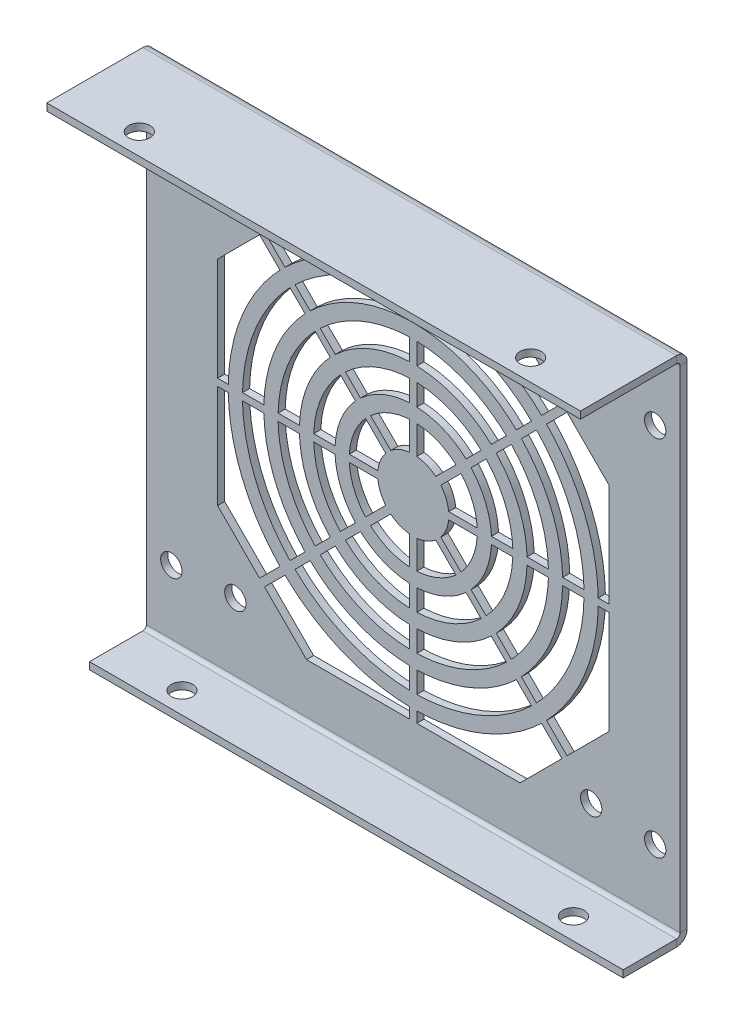
from build123d import *

# Parameters (mm, degrees)
SZKIC1_W                   = 150
SZKIC1_H                   = 138
ODGI_CIE_BAZOWE1_DEPTH     = 2
ODGI_CIE_KRAW_DZI1_DEPTH   = 150
ODGI_CIE_KRAW_DZI2_DEPTH   = 150
WYTNIJ_WYCI_GNI_CIE1_REACH = 166.757
SZKIC12_R                  = 3
OTW_R_START                = -2
OTW_R_WENTYLACYJNY1_DEPTH  = 2
WYTNIJ_WYCI_GNI_CIE2_REACH = 110.208
SZKIC14_R                  = 3
WYTNIJ_WYCI_GNI_CIE3_REACH = 166.757
SZKIC15_R                  = 3
SZKIC16_R                  = 3
WYTNIJ_WYCI_GNI_CIE4_DEPTH = 2


# Read off the part's stored shape, not the designer's step: Otwór wentylacyjny1
# Sheet-metal steps are written as plain solids
with BuildPart() as part:
    # Szkic1 → Odgięcie bazowe1 (new body)
    with BuildSketch(Plane.XY):
        Rectangle(SZKIC1_W, SZKIC1_H)
    extrude(amount=-ODGI_CIE_BAZOWE1_DEPTH)

    # Odgięcie krawędzi1 section (across the edge) → Odgięcie krawędzi1 (add)
    with BuildSketch(Plane(origin=(75, 70, 0), x_dir=(0, -1, 0), z_dir=(-1, 0, 0))):
        with BuildLine():
            Line((-2, 1), (-2, 28))
            Line((-2, 28), (0, 28))
            Line((0, 28), (0, 1))
            ThreePointArc((0, 1), (0.292893219, 0.292893219), (1, 0))
            Line((1, 0), (1, -2))
            ThreePointArc((1, -2), (-1.121320344, -1.121320344), (-2, 1))
        make_face()
    extrude(amount=ODGI_CIE_KRAW_DZI1_DEPTH)

    # Odgięcie krawędzi2 section (across the edge) → Odgięcie krawędzi2 (add)
    with BuildSketch(Plane(origin=(-75, -70, 0), x_dir=(0, 1, 0), z_dir=(1, 0, 0))):
        with BuildLine():
            Line((-2, 1), (-2, 16))
            Line((-2, 16), (0, 16))
            Line((0, 16), (0, 1))
            ThreePointArc((0, 1), (0.292893219, 0.292893219), (1, 0))
            Line((1, 0), (1, -2))
            ThreePointArc((1, -2), (-1.121320344, -1.121320344), (-2, 1))
        make_face()
    extrude(amount=ODGI_CIE_KRAW_DZI2_DEPTH)

    # Szkic12 → Wytnij-wyciągnięcie1 (cut, up to next)
    with BuildSketch(Plane.XZ.offset(72), mode=Mode.PRIVATE) as wytnij_wyci_gni_cie1_sk1:
        with Locations(Location((55, 10, 0), (0, 0, 270))):
            Circle(SZKIC12_R)
    wytnij_wyci_gni_cie1_tool1 = extrude(wytnij_wyci_gni_cie1_sk1.sketch, amount=-WYTNIJ_WYCI_GNI_CIE1_REACH, mode=Mode.PRIVATE) & part.part
    # Szkic12 → Wytnij-wyciągnięcie1 (cut, up to next)
    with BuildSketch(Plane.XZ.offset(72), mode=Mode.PRIVATE) as wytnij_wyci_gni_cie1_sk2:
        with Locations(Location((-55, 10, 0), (0, 0, 270))):
            Circle(SZKIC12_R)
    wytnij_wyci_gni_cie1_tool2 = extrude(wytnij_wyci_gni_cie1_sk2.sketch, amount=-WYTNIJ_WYCI_GNI_CIE1_REACH, mode=Mode.PRIVATE) & part.part
    add(wytnij_wyci_gni_cie1_tool1.solids().sort_by_distance((55, -72, 10))[0], mode=Mode.SUBTRACT)
    add(wytnij_wyci_gni_cie1_tool2.solids().sort_by_distance((-55, -72, 10))[0], mode=Mode.SUBTRACT)

    # Otwór wentylacyjny1 outline → Otwór wentylacyjny1 (cut)
    with BuildSketch(Plane.XY.offset(OTW_R_START)):
        with BuildLine():
            add(Edge.make_bspline(
                [(17.972154654, -0.999994577), (17.92518573, -1.843278811), (17.670657872, -3.854948802), (16.737030702, -6.932705111), (15.220903299, -9.769179978), (13.978417538, -11.37162259), (13.41533897, -12.001125464)],
                knots=[0.508846507, 0.508846507, 0.508846507, 0.508846507, 0.53125, 0.5625, 0.59375, 0.616153445, 0.616153445, 0.616153445, 0.616153445], degree=3))
            Line((17.972154654, -0.999994577), (9.949835903, -0.999992261))
            add(Edge.make_bspline(
                [(9.949835903, -0.999992261), (9.917776111, -1.318994773), (9.773684791, -2.28453532), (9.29835039, -3.851502839), (8.5264492, -5.295628394), (7.945596866, -6.080256627), (7.742697709, -6.328495177)],
                knots=[0.515942077, 0.515942077, 0.515942077, 0.515942077, 0.53125, 0.5625, 0.59375, 0.609057924, 0.609057924, 0.609057924, 0.609057924], degree=3))
            Line((7.742697709, -6.328495177), (13.41533897, -12.001125464))
        make_face()
        with BuildLine():
            Line((27.982098436, -0.999999047), (21.97721779, -0.999991626))
            add(Edge.make_bspline(
                [(21.97721779, -0.999991626), (21.926857838, -2.105291108), (21.619105132, -4.640285032), (20.456370859, -8.473306247), (18.568193593, -12.005837448), (16.993297414, -14.015961788), (16.247343743, -14.833135418)],
                knots=[0.507236801, 0.507236801, 0.507236801, 0.507236801, 0.53125, 0.5625, 0.59375, 0.617763165, 0.617763165, 0.617763165, 0.617763165], degree=3))
            Line((16.247343743, -14.833135418), (20.493438313, -19.079224751))
            add(Edge.make_bspline(
                [(27.982098436, -0.999999047), (27.928465846, -2.498222405), (27.541762876, -5.818332716), (26.035381093, -10.78420795), (23.589149965, -15.360784495), (21.514917987, -17.981897084), (20.493438313, -19.079224751)],
                knots=[0.505685352, 0.505685352, 0.505685352, 0.505685352, 0.53125, 0.5625, 0.59375, 0.619314642, 0.619314642, 0.619314642, 0.619314642], degree=3))
        make_face()
        with BuildLine():
            Line((37.986912574, -0.999999173), (31.984335524, -0.999995217))
            add(Edge.make_bspline(
                [(31.984335524, -0.999995217), (31.929202331, -2.760129716), (31.490198533, -6.603707199), (29.754721249, -12.324809086), (26.936459813, -17.597405383), (24.529063897, -20.625646567), (23.323447183, -21.909233689)],
                knots=[0.504974417, 0.504974417, 0.504974417, 0.504974417, 0.53125, 0.5625, 0.59375, 0.62002556, 0.62002556, 0.62002556, 0.62002556], degree=3))
            Line((23.323447183, -21.909233689), (27.567910075, -26.15369654))
            add(Edge.make_bspline(
                [(37.986912574, -0.999999173), (37.963083041, -1.909793354), (37.829614903, -4.060771875), (37.329363483, -7.425084608), (36.423065203, -11.048718928), (35.163528082, -14.56501123), (33.567708091, -17.942208419), (31.646377994, -21.145212611), (29.621092606, -23.878032891), (28.194508233, -25.49339135), (27.567910075, -26.15369654)],
                knots=[0.504188671, 0.504188671, 0.504188671, 0.504188671, 0.515623838, 0.531249994, 0.546873838, 0.562499994, 0.578123838, 0.593749994, 0.609373838, 0.620811315, 0.620811315, 0.620811315, 0.620811315], degree=3))
        make_face()
        with BuildLine():
            Line((47.989641865, -0.999999407), (41.988160457, -0.999999297))
            add(Edge.make_bspline(
                [(41.988160457, -0.999999297), (41.963502563, -2.040731707), (41.816845975, -4.453481293), (41.258763128, -8.206707835), (40.257066776, -12.211759418), (38.86493829, -16.09820363), (37.101142449, -19.830878006), (34.977555668, -23.371054487), (32.718167772, -26.419756732), (31.115808267, -28.229540392), (30.397219707, -28.983006173)],
                knots=[0.503789671, 0.503789671, 0.503789671, 0.503789671, 0.515624044, 0.531249995, 0.546874044, 0.562499995, 0.578124044, 0.593749995, 0.609374044, 0.621210318, 0.621210318, 0.621210318, 0.621210318], degree=3))
            Line((30.397219707, -28.983006173), (34.640907915, -33.226694381))
            add(Edge.make_bspline(
                [(47.989641865, -0.999999407), (47.964000859, -2.23711994), (47.797693562, -5.042535913), (47.152867488, -9.379118087), (46.008072813, -13.956308027), (44.417063193, -18.397969065), (42.401299968, -22.663871222), (39.974336069, -26.70979641), (37.36379037, -30.232330256), (35.497669058, -32.333666382), (34.640907915, -33.226694381)],
                knots=[0.503315888, 0.503315888, 0.503315888, 0.503315888, 0.515624164, 0.531249996, 0.546874164, 0.562499996, 0.578124164, 0.593749996, 0.609374164, 0.621684102, 0.621684102, 0.621684102, 0.621684102], degree=3))
        make_face()
        with BuildLine():
            Line((55, -1), (51.990439352, -0.999999475))
            add(Edge.make_bspline(
                [(51.990439352, -0.999999475), (51.96426927, -2.368033493), (51.784926007, -5.43523196), (51.082273655, -10.160708529), (49.84207929, -15.119332349), (48.11848619, -19.931130578), (45.934742303, -24.552525924), (43.305532263, -28.93561043), (40.460878279, -32.774038371), (38.418867442, -35.069701415), (37.469898854, -36.05568532)],
                knots=[0.503060787, 0.503060787, 0.503060787, 0.503060787, 0.515624151, 0.531249996, 0.546874151, 0.562499996, 0.578124151, 0.593749996, 0.609374151, 0.621939204, 0.621939204, 0.621939204, 0.621939204], degree=3))
            Line((37.469898854, -36.05568532), (43.207106781, -41.792893219))
            Line((43.207106781, -41.792893219), (55, -30))
            Line((55, -30), (55, -1))
        make_face()
        with BuildLine():
            Line((-20.493437663, -19.079225449), (-16.247343424, -14.833135768))
            add(Edge.make_bspline(
                [(-16.247343424, -14.833135768), (-16.993297219, -14.015962037), (-18.568193519, -12.005837588), (-20.456370859, -8.473306247), (-21.619105106, -4.640285119), (-21.926857816, -2.105291286), (-21.977217778, -0.999991895)],
                knots=[0.882236831, 0.882236831, 0.882236831, 0.882236831, 0.90625, 0.9375, 0.96875, 0.992763197, 0.992763197, 0.992763197, 0.992763197], degree=3))
            Line((-21.977217778, -0.999991895), (-27.982098437, -0.999999006))
            add(Edge.make_bspline(
                [(-20.493437663, -19.079225449), (-21.514917592, -17.981897584), (-23.589149814, -15.360784777), (-26.035381093, -10.78420795), (-27.54176288, -5.818332703), (-27.92846585, -2.498222378), (-27.982098437, -0.999999006)],
                knots=[0.880685352, 0.880685352, 0.880685352, 0.880685352, 0.90625, 0.9375, 0.96875, 0.994314648, 0.994314648, 0.994314648, 0.994314648], degree=3))
        make_face()
        with BuildLine():
            add(Edge.make_bspline(
                [(-13.415335376, -12.001129482), (-13.978415331, -11.371625437), (-15.220902448, -9.76918157), (-16.737030702, -6.932705111), (-17.670657863, -3.854948831), (-17.925185722, -1.843278871), (-17.972154649, -0.999994668)],
                knots=[0.883846507, 0.883846507, 0.883846507, 0.883846507, 0.90625, 0.9375, 0.96875, 0.991153492, 0.991153492, 0.991153492, 0.991153492], degree=3))
            Line((-13.415335376, -12.001129482), (-7.742697748, -6.32849513))
            add(Edge.make_bspline(
                [(-7.742697748, -6.32849513), (-7.94559689, -6.080256594), (-8.526449209, -5.295628376), (-9.29835039, -3.851502839), (-9.773684862, -2.284535086), (-9.917776183, -1.31899429), (-9.949835976, -0.999991534)],
                knots=[0.890942077, 0.890942077, 0.890942077, 0.890942077, 0.90625, 0.9375, 0.96875, 0.984057935, 0.984057935, 0.984057935, 0.984057935], degree=3))
            Line((-9.949835976, -0.999991534), (-17.972154649, -0.999994668))
        make_face()
        with BuildLine():
            Line((-27.567909673, -26.15369728), (-23.323445584, -21.909235391))
            add(Edge.make_bspline(
                [(-23.323445584, -21.909235391), (-24.529062925, -20.62564779), (-26.936459444, -17.597406073), (-29.754721249, -12.324809086), (-31.49019851, -6.603707275), (-31.929202313, -2.760129874), (-31.984335516, -0.999995455)],
                knots=[0.879974429, 0.879974429, 0.879974429, 0.879974429, 0.90625, 0.9375, 0.96875, 0.995025582, 0.995025582, 0.995025582, 0.995025582], degree=3))
            Line((-31.984335516, -0.999995455), (-37.986917849, -0.999999391))
            add(Edge.make_bspline(
                [(-27.567909673, -26.15369728), (-28.194387047, -25.493519545), (-29.620981826, -23.878171313), (-31.646182992, -21.145504478), (-33.567624557, -17.942364883), (-35.163393389, -14.565335456), (-36.423015107, -11.048888883), (-37.329299989, -7.425387319), (-37.829617349, -4.060907877), (-37.963089265, -1.909927895), (-37.986917849, -0.999999391)],
                knots=[0.879188671, 0.879188671, 0.879188671, 0.879188671, 0.890623944, 0.906249995, 0.921873944, 0.937499995, 0.953123944, 0.968749995, 0.984374472, 0.995811324, 0.995811324, 0.995811324, 0.995811324], degree=3))
        make_face()
        with BuildLine():
            Line((-34.640907552, -33.226694828), (-30.397219516, -28.983006451))
            add(Edge.make_bspline(
                [(-30.397219516, -28.983006451), (-31.115692611, -28.229661821), (-32.718062253, -26.419888441), (-34.977369926, -23.371332426), (-37.101062903, -19.831027027), (-38.864809991, -16.098512413), (-40.257019132, -12.211921289), (-41.258702896, -8.206994154), (-41.816849714, -4.453609013), (-41.963509092, -2.040857902), (-41.988165261, -0.99999957)],
                knots=[0.878789672, 0.878789672, 0.878789672, 0.878789672, 0.890624044, 0.906249995, 0.921874044, 0.937499995, 0.953124044, 0.968749995, 0.984374522, 0.996210324, 0.996210324, 0.996210324, 0.996210324], degree=3))
            Line((-41.988165261, -0.99999957), (-47.989646101, -0.999999563))
            add(Edge.make_bspline(
                [(-34.640907552, -33.226694828), (-35.497552942, -32.333787581), (-37.363684586, -30.232461905), (-39.974150327, -26.710074349), (-42.401220422, -22.664020243), (-44.416934895, -18.398277848), (-46.008025169, -13.956469898), (-47.152807255, -9.379404406), (-47.797697737, -5.042663688), (-47.96400748, -2.237246038), (-47.989646101, -0.999999563)],
                knots=[0.878315888, 0.878315888, 0.878315888, 0.878315888, 0.890624164, 0.906249996, 0.921874164, 0.937499996, 0.953124164, 0.968749996, 0.984374582, 0.996684108, 0.996684108, 0.996684108, 0.996684108], degree=3))
        make_face()
        with BuildLine():
            Line((-43.207106781, -41.792893219), (-37.469898818, -36.055685617))
            add(Edge.make_bspline(
                [(-37.469898818, -36.055685617), (-38.418745645, -35.06982847), (-40.460767067, -32.774176324), (-43.305337261, -28.935902297), (-45.934658768, -24.552682387), (-48.118351497, -19.931454805), (-49.842029194, -15.119502304), (-51.082210162, -10.161011241), (-51.784929505, -5.435368188), (-51.964275766, -2.368167983), (-51.990443272, -0.999999681)],
                knots=[0.878060788, 0.878060788, 0.878060788, 0.878060788, 0.890624228, 0.906249996, 0.921874228, 0.937499996, 0.953124228, 0.968749996, 0.984374614, 0.996939209, 0.996939209, 0.996939209, 0.996939209], degree=3))
            Line((-51.990443272, -0.999999681), (-55, -1))
            Line((-55, -1), (-55, -30))
            Line((-55, -30), (-43.207106781, -41.792893219))
        make_face()
        with BuildLine():
            Line((-1, -27.982098402), (-0.999999956, -21.977217411))
            add(Edge.make_bspline(
                [(-0.999999956, -21.977217411), (-2.105296642, -21.926857166), (-4.640287705, -21.619104321), (-8.473306247, -20.456370859), (-12.005838549, -18.568193005), (-14.015963749, -16.993295877), (-14.833138171, -16.24734123)],
                knots=[0.757236861, 0.757236861, 0.757236861, 0.757236861, 0.78125, 0.8125, 0.84375, 0.867763192, 0.867763192, 0.867763192, 0.867763192], degree=3))
            Line((-14.833138171, -16.24734123), (-19.07922527, -20.493437829))
            add(Edge.make_bspline(
                [(-1, -27.982098402), (-2.498223039, -27.928465773), (-5.818333022, -27.541762784), (-10.78420795, -26.035381093), (-15.360784705, -23.589149853), (-17.981897457, -21.514917693), (-19.07922527, -20.493437829)],
                knots=[0.755685358, 0.755685358, 0.755685358, 0.755685358, 0.78125, 0.8125, 0.84375, 0.869314646, 0.869314646, 0.869314646, 0.869314646], degree=3))
        make_face()
        with BuildLine():
            add(Edge.make_bspline(
                [(-0.999994577, -17.972154654), (-1.843278811, -17.92518573), (-3.854948802, -17.670657872), (-6.932705111, -16.737030702), (-9.769182848, -15.220901765), (-11.37162772, -13.97841356), (-12.001132704, -13.415332493)],
                knots=[0.758846507, 0.758846507, 0.758846507, 0.758846507, 0.78125, 0.8125, 0.84375, 0.866153531, 0.866153531, 0.866153531, 0.866153531], degree=3))
            Line((-0.999994577, -17.972154654), (-0.999992261, -9.949835903))
            add(Edge.make_bspline(
                [(-0.999992261, -9.949835903), (-1.318994773, -9.917776111), (-2.28453532, -9.773684791), (-3.851502839, -9.29835039), (-5.295628394, -8.5264492), (-6.080256628, -7.945596866), (-6.328495178, -7.742697709)],
                knots=[0.765942077, 0.765942077, 0.765942077, 0.765942077, 0.78125, 0.8125, 0.84375, 0.859057924, 0.859057924, 0.859057924, 0.859057924], degree=3))
            Line((-6.328495178, -7.742697709), (-12.001132704, -13.415332493))
        make_face()
        with BuildLine():
            Line((-0.999999999, -37.98691255), (-0.999999964, -31.984335375))
            add(Edge.make_bspline(
                [(-0.999999964, -31.984335375), (-2.760132873, -31.929201971), (-6.603708722, -31.490198071), (-12.324809086, -29.754721249), (-17.597406598, -26.936459163), (-20.625648721, -24.529062185), (-21.909236688, -23.323444366)],
                knots=[0.75497444, 0.75497444, 0.75497444, 0.75497444, 0.78125, 0.8125, 0.84375, 0.87002558, 0.87002558, 0.87002558, 0.87002558], degree=3))
            Line((-21.909236688, -23.323444366), (-26.15369689, -27.56790996))
            add(Edge.make_bspline(
                [(-0.999999999, -37.98691255), (-1.909802275, -37.963082783), (-4.060780527, -37.829613928), (-7.425101001, -37.329360222), (-11.048727012, -36.423062751), (-14.565026673, -35.163521687), (-17.942215862, -33.567704103), (-21.145226539, -31.646368734), (-23.87803946, -29.621087192), (-25.493397747, -28.19450247), (-26.15369689, -27.56790996)],
                knots=[0.754188675, 0.754188675, 0.754188675, 0.754188675, 0.765623944, 0.781249995, 0.796873944, 0.812499995, 0.828123944, 0.843749995, 0.859373944, 0.870811317, 0.870811317, 0.870811317, 0.870811317], degree=3))
        make_face()
        with BuildLine():
            Line((-0.999999999, -47.989641853), (-0.999999999, -41.988160441))
            add(Edge.make_bspline(
                [(-0.999999999, -41.988160441), (-2.040732175, -41.963502535), (-4.453481524, -41.816845941), (-8.206707835, -41.258763128), (-12.211759418, -40.257066776), (-16.09820363, -38.86493829), (-19.830878006, -37.101142449), (-23.371054487, -34.977555668), (-26.419756815, -32.718167711), (-28.229540544, -31.115808131), (-28.983006395, -30.397219495)],
                knots=[0.753789673, 0.753789673, 0.753789673, 0.753789673, 0.765624044, 0.781249995, 0.796874044, 0.812499995, 0.828124044, 0.843749995, 0.859374044, 0.871210319, 0.871210319, 0.871210319, 0.871210319], degree=3))
            Line((-28.983006395, -30.397219495), (-33.226694553, -34.640907749))
            add(Edge.make_bspline(
                [(-0.999999999, -47.989641853), (-2.237120334, -47.964000835), (-5.042536109, -47.797693533), (-9.379118087, -47.152867488), (-13.956308027, -46.008072813), (-18.397969065, -44.417063193), (-22.663871222, -42.401299968), (-26.70979641, -39.974336069), (-30.232330321, -37.363790322), (-32.333666501, -35.497668951), (-33.226694553, -34.640907749)],
                knots=[0.75331589, 0.75331589, 0.75331589, 0.75331589, 0.765624164, 0.781249996, 0.796874164, 0.812499996, 0.828124164, 0.843749996, 0.859374164, 0.871684103, 0.871684103, 0.871684103, 0.871684103], degree=3))
        make_face()
        with BuildLine():
            Line((-1, -55), (-0.999999999, -51.990439339))
            add(Edge.make_bspline(
                [(-0.999999999, -51.990439339), (-2.368042213, -51.964269085), (-5.43524052, -51.784925075), (-10.160724921, -51.082270394), (-15.119340433, -49.842076838), (-19.931146022, -48.118479796), (-24.552533366, -45.934738314), (-28.935624358, -43.305523003), (-32.774044894, -40.460872856), (-35.069707741, -38.418861701), (-36.055685577, -37.469898794)],
                knots=[0.753060789, 0.753060789, 0.753060789, 0.753060789, 0.765624228, 0.781249996, 0.796874228, 0.812499996, 0.828124228, 0.843749996, 0.859374228, 0.871939205, 0.871939205, 0.871939205, 0.871939205], degree=3))
            Line((-36.055685577, -37.469898794), (-41.792893219, -43.207106781))
            Line((-41.792893219, -43.207106781), (-30, -55))
            Line((-30, -55), (-1, -55))
        make_face()
        with BuildLine():
            add(Edge.make_bspline(
                [(13.415335376, 12.001129482), (13.978415331, 11.371625437), (15.220902448, 9.76918157), (16.737030702, 6.932705111), (17.670657817, 3.854948982), (17.925185683, 1.843279185), (17.972154623, 0.99999514)],
                knots=[0.383846507, 0.383846507, 0.383846507, 0.383846507, 0.40625, 0.4375, 0.46875, 0.491153488, 0.491153488, 0.491153488, 0.491153488], degree=3))
            Line((13.415335376, 12.001129482), (7.742697748, 6.32849513))
            add(Edge.make_bspline(
                [(7.742697748, 6.32849513), (7.94559689, 6.080256594), (8.526449209, 5.295628376), (9.29835039, 3.851502839), (9.773684797, 2.2845353), (9.917776117, 1.318994732), (9.949835909, 0.9999922)],
                knots=[0.390942077, 0.390942077, 0.390942077, 0.390942077, 0.40625, 0.4375, 0.46875, 0.484057924, 0.484057924, 0.484057924, 0.484057924], degree=3))
            Line((9.949835909, 0.9999922), (17.972154623, 0.99999514))
        make_face()
        with BuildLine():
            Line((20.493438313, 19.079224751), (16.247346213, 14.833132713))
            add(Edge.make_bspline(
                [(16.247346213, 14.833132713), (16.993298924, 14.01595986), (18.568194172, 12.005836366), (20.456370859, 8.473306247), (21.61910504, 4.640285337), (21.926857761, 2.105291737), (21.977217747, 0.999992573)],
                knots=[0.382236861, 0.382236861, 0.382236861, 0.382236861, 0.40625, 0.4375, 0.46875, 0.492763192, 0.492763192, 0.492763192, 0.492763192], degree=3))
            Line((21.977217747, 0.999992573), (27.982098414, 0.999999645))
            add(Edge.make_bspline(
                [(20.493438313, 19.079224751), (21.514917988, 17.981897084), (23.589149965, 15.360784495), (26.035381093, 10.78420795), (27.541762818, 5.818332908), (27.9284658, 2.498222803), (27.982098414, 0.999999645)],
                knots=[0.380685358, 0.380685358, 0.380685358, 0.380685358, 0.40625, 0.4375, 0.46875, 0.494314644, 0.494314644, 0.494314644, 0.494314644], degree=3))
        make_face()
        with BuildLine():
            Line((27.567910243, 26.153696682), (23.323447192, 21.909233679))
            add(Edge.make_bspline(
                [(23.323447192, 21.909233679), (24.529063903, 20.62564656), (26.936459815, 17.597405379), (29.754721249, 12.324809086), (31.490198472, 6.603707399), (31.929202284, 2.76013013), (31.984335504, 0.999995839)],
                knots=[0.37997444, 0.37997444, 0.37997444, 0.37997444, 0.40625, 0.4375, 0.46875, 0.49502558, 0.49502558, 0.49502558, 0.49502558], degree=3))
            Line((31.984335504, 0.999995839), (37.986912493, 0.999999826))
            add(Edge.make_bspline(
                [(27.567910243, 26.153696682), (28.194381649, 25.493525209), (29.620976722, 23.878177677), (31.646173733, 21.145518379), (33.567620473, 17.942372319), (35.163387369, 14.565350949), (36.423011252, 11.048896779), (37.329291747, 7.425445249), (37.829594298, 4.060956433), (37.96307808, 1.909977953), (37.986912493, 0.999999826)],
                knots=[0.379188674, 0.379188674, 0.379188674, 0.379188674, 0.390623838, 0.406249994, 0.421873838, 0.437499994, 0.453123838, 0.468749994, 0.484373838, 0.495811316, 0.495811316, 0.495811316, 0.495811316], degree=3))
        make_face()
        with BuildLine():
            Line((34.640907962, 33.226694401), (30.397219758, 28.983006197))
            add(Edge.make_bspline(
                [(30.397219758, 28.983006197), (31.115692764, 28.229661645), (32.718062318, 26.419888347), (34.977369953, 23.37133243), (37.101062803, 19.831027013), (38.864810367, 16.098512463), (40.25701773, 12.211921101), (41.258697914, 8.207035691), (41.816827457, 4.453649056), (41.963498481, 2.040899382), (41.988160395, 0.999999673)],
                knots=[0.378789673, 0.378789673, 0.378789673, 0.378789673, 0.390624044, 0.406249995, 0.421874044, 0.437499995, 0.453124044, 0.468749995, 0.484374044, 0.496210319, 0.496210319, 0.496210319, 0.496210319], degree=3))
            Line((41.988160395, 0.999999673), (47.989641808, 0.99999987))
            add(Edge.make_bspline(
                [(34.640907962, 33.226694401), (35.497553202, 32.333787285), (37.363684699, 30.232461745), (39.974150354, 26.710074352), (42.401220322, 22.66402023), (44.41693527, 18.398277899), (46.008023767, 13.956469709), (47.152802273, 9.379445943), (47.797675282, 5.04270377), (47.963997271, 2.237287674), (47.989641808, 0.99999987)],
                knots=[0.37831589, 0.37831589, 0.37831589, 0.37831589, 0.390624164, 0.406249996, 0.421874164, 0.437499996, 0.453124164, 0.468749996, 0.484374164, 0.496684102, 0.496684102, 0.496684102, 0.496684102], degree=3))
        make_face()
        with BuildLine():
            Line((43.207106781, 41.792893219), (37.469898996, 36.055685435))
            add(Edge.make_bspline(
                [(37.469898996, 36.055685435), (38.418739953, 35.069834378), (40.460761823, 32.774182826), (43.305328003, 28.935916198), (45.934654685, 24.552689824), (48.118345477, 19.931470297), (49.842025339, 15.119510199), (51.08220192, 10.16106917), (51.784906053, 5.435416569), (51.964265627, 2.368217856), (51.990439297, 0.999999769)],
                knots=[0.378060788, 0.378060788, 0.378060788, 0.378060788, 0.390624151, 0.406249996, 0.421874151, 0.437499996, 0.453124151, 0.468749996, 0.484374151, 0.496939204, 0.496939204, 0.496939204, 0.496939204], degree=3))
            Line((51.990439297, 0.999999769), (55, 1))
            Line((55, 1), (55, 30))
            Line((55, 30), (43.207106781, 41.792893219))
        make_face()
        with BuildLine():
            add(Edge.make_bspline(
                [(-12.001129459, 13.415335396), (-11.37162542, 13.978415343), (-9.769181561, 15.220902453), (-6.932705111, 16.737030702), (-3.85495053, 17.670657348), (-1.843282385, 17.925185278), (-0.99999996, 17.972154355)],
                knots=[0.133846508, 0.133846508, 0.133846508, 0.133846508, 0.15625, 0.1875, 0.21875, 0.241153445, 0.241153445, 0.241153445, 0.241153445], degree=3))
            Line((-12.001129459, 13.415335396), (-6.328495134, 7.742697745))
            add(Edge.make_bspline(
                [(-6.328495134, 7.742697745), (-6.080256597, 7.945596888), (-5.295628377, 8.526449208), (-3.851502839, 9.29835039), (-2.2845353, 9.773684797), (-1.318994732, 9.917776117), (-0.9999922, 9.949835909)],
                knots=[0.140942077, 0.140942077, 0.140942077, 0.140942077, 0.15625, 0.1875, 0.21875, 0.234057924, 0.234057924, 0.234057924, 0.234057924], degree=3))
            Line((-0.9999922, 9.949835909), (-0.99999996, 17.972154355))
        make_face()
        with BuildLine():
            Line((-19.079224751, 20.493438313), (-14.833135768, 16.247343424))
            add(Edge.make_bspline(
                [(-14.833135768, 16.247343424), (-14.015962037, 16.993297219), (-12.005837588, 18.568193519), (-8.473306247, 20.456370859), (-4.640287707, 21.619104321), (-2.105296645, 21.926857165), (-0.999999961, 21.977217411)],
                knots=[0.132236831, 0.132236831, 0.132236831, 0.132236831, 0.15625, 0.1875, 0.21875, 0.242763139, 0.242763139, 0.242763139, 0.242763139], degree=3))
            Line((-0.999999961, 21.977217411), (-0.999999999, 27.982098402))
            add(Edge.make_bspline(
                [(-19.079224751, 20.493438313), (-17.981897084, 21.514917988), (-15.360784495, 23.589149965), (-10.78420795, 26.035381093), (-5.818333021, 27.541762784), (-2.498223039, 27.928465773), (-0.999999999, 27.982098402)],
                knots=[0.130685358, 0.130685358, 0.130685358, 0.130685358, 0.15625, 0.1875, 0.21875, 0.244314642, 0.244314642, 0.244314642, 0.244314642], degree=3))
        make_face()
        with BuildLine():
            Line((-27.982098426, 0.999999331), (-21.977217584, 0.999996162))
            add(Edge.make_bspline(
                [(-21.977217584, 0.999996162), (-21.926857472, 2.105294121), (-21.619104691, 4.640286488), (-20.456370859, 8.473306247), (-18.568193593, 12.005837448), (-16.993297414, 14.015961788), (-16.247343743, 14.833135418)],
                knots=[0.007236834, 0.007236834, 0.007236834, 0.007236834, 0.03125, 0.0625, 0.09375, 0.117763165, 0.117763165, 0.117763165, 0.117763165], degree=3))
            Line((-16.247343743, 14.833135418), (-20.493438299, 19.079224765))
            add(Edge.make_bspline(
                [(-27.982098426, 0.999999331), (-27.928465824, 2.498222594), (-27.541762849, 5.818332807), (-26.035381093, 10.78420795), (-23.589149962, 15.360784501), (-21.514917979, 17.981897095), (-20.493438299, 19.079224765)],
                knots=[0.005685354, 0.005685354, 0.005685354, 0.005685354, 0.03125, 0.0625, 0.09375, 0.119314643, 0.119314643, 0.119314643, 0.119314643], degree=3))
        make_face()
        with BuildLine():
            add(Edge.make_bspline(
                [(-17.972154905, 0.999990076), (-17.925186108, 1.843275822), (-17.67065831, 3.854947357), (-16.737030702, 6.932705111), (-15.220903299, 9.769179978), (-13.978417538, 11.37162259), (-13.41533897, 12.001125464)],
                knots=[0.008846468, 0.008846468, 0.008846468, 0.008846468, 0.03125, 0.0625, 0.09375, 0.116153445, 0.116153445, 0.116153445, 0.116153445], degree=3))
            Line((-17.972154905, 0.999990076), (-9.949835837, 0.999992925))
            add(Edge.make_bspline(
                [(-9.949835837, 0.999992925), (-9.917776045, 1.318995213), (-9.773684726, 2.284535534), (-9.29835039, 3.851502839), (-8.5264492, 5.295628394), (-7.945596866, 6.080256627), (-7.742697709, 6.328495177)],
                knots=[0.015942087, 0.015942087, 0.015942087, 0.015942087, 0.03125, 0.0625, 0.09375, 0.109057924, 0.109057924, 0.109057924, 0.109057924], degree=3))
            Line((-7.742697709, 6.328495177), (-13.41533897, 12.001125464))
        make_face()
        with BuildLine():
            Line((-26.153696696, 27.56791023), (-21.909233693, 23.323447179))
            add(Edge.make_bspline(
                [(-21.909233693, 23.323447179), (-20.62564657, 24.529063895), (-17.597405384, 26.936459812), (-12.324809086, 29.754721249), (-6.603708723, 31.49019807), (-2.760132876, 31.92920197), (-0.99999997, 31.984335375)],
                knots=[0.12997444, 0.12997444, 0.12997444, 0.12997444, 0.15625, 0.1875, 0.21875, 0.24502556, 0.24502556, 0.24502556, 0.24502556], degree=3))
            Line((-0.99999997, 31.984335375), (-1, 37.986912489))
            add(Edge.make_bspline(
                [(-26.153696696, 27.56791023), (-25.493525219, 28.194381641), (-23.878177681, 29.620976718), (-21.145518379, 31.646173733), (-17.942372319, 33.567620473), (-14.565350949, 35.163387369), (-11.048896779, 36.423011252), (-7.425445249, 37.329291747), (-4.06095649, 37.829594289), (-1.909978069, 37.963078073), (-1, 37.986912489)],
                knots=[0.129188674, 0.129188674, 0.129188674, 0.129188674, 0.140623838, 0.156249994, 0.171873838, 0.187499994, 0.203123838, 0.218749994, 0.234373838, 0.245811315, 0.245811315, 0.245811315, 0.245811315], degree=3))
        make_face()
        with BuildLine():
            Line((-37.986907019, 0.99999943), (-31.984335443, 0.999997808))
            add(Edge.make_bspline(
                [(-31.984335443, 0.999997808), (-31.929202135, 2.760131439), (-31.490198281, 6.60370803), (-29.754721249, 12.324809086), (-26.936459813, 17.597405383), (-24.529063897, 20.625646568), (-23.323447182, 21.90923369)],
                knots=[0.00497443, 0.00497443, 0.00497443, 0.00497443, 0.03125, 0.0625, 0.09375, 0.12002556, 0.12002556, 0.12002556, 0.12002556], degree=3))
            Line((-23.323447182, 21.90923369), (-27.567910196, 26.153696637))
            add(Edge.make_bspline(
                [(-37.986907019, 0.99999943), (-37.963071438, 1.909839037), (-37.829590309, 4.060816022), (-37.329358088, 7.425130285), (-36.423063638, 11.048718722), (-35.163528503, 14.565011287), (-33.567707972, 17.942208396), (-31.646378051, 21.145212646), (-29.621092519, 23.878032779), (-28.194508381, 25.493391496), (-27.567910196, 26.153696637)],
                knots=[0.004188678, 0.004188678, 0.004188678, 0.004188678, 0.015624419, 0.031249994, 0.046873838, 0.062499994, 0.078123838, 0.093749994, 0.109373838, 0.120811315, 0.120811315, 0.120811315, 0.120811315], degree=3))
        make_face()
        with BuildLine():
            Line((-33.226694429, 34.640907963), (-28.983006228, 30.397219761))
            add(Edge.make_bspline(
                [(-28.983006228, 30.397219761), (-28.229667744, 31.115687017), (-26.419894979, 32.718057122), (-23.371342667, 34.977362674), (-19.831031747, 37.101062699), (-16.098516165, 38.864808438), (-12.21192117, 40.257017867), (-8.207035672, 41.258697877), (-4.453649166, 41.816827447), (-2.040899601, 41.96349847), (-1, 41.988160389)],
                knots=[0.128789673, 0.128789673, 0.128789673, 0.128789673, 0.140623949, 0.156249995, 0.171873996, 0.187499995, 0.203124044, 0.218749995, 0.234374044, 0.246210318, 0.246210318, 0.246210318, 0.246210318], degree=3))
            Line((-1, 41.988160389), (-1, 47.989641807))
            add(Edge.make_bspline(
                [(-33.226694429, 34.640907963), (-32.333793365, 35.497547437), (-30.232468375, 37.363679499), (-26.710084589, 39.974143075), (-22.664024963, 42.401220218), (-18.3982816, 44.416933342), (-13.956469779, 46.008023904), (-9.379445924, 47.152802237), (-5.042703816, 47.797675282), (-2.237287761, 47.963997269), (-1, 47.989641807)],
                knots=[0.12831589, 0.12831589, 0.12831589, 0.12831589, 0.14062408, 0.156249996, 0.171874122, 0.187499996, 0.203124164, 0.218749996, 0.234374164, 0.246684102, 0.246684102, 0.246684102, 0.246684102], degree=3))
        make_face()
        with BuildLine():
            Line((-47.989637442, 0.999999582), (-41.988155414, 0.9999997))
            add(Edge.make_bspline(
                [(-41.988155414, 0.9999997), (-41.963491548, 2.040769131), (-41.81682212, 4.453517079), (-41.258760994, 8.20673712), (-40.257067663, 12.211751128), (-38.864945105, 16.098188243), (-37.101146318, 19.830870541), (-34.977564983, 23.371040592), (-32.718173047, 26.419750155), (-31.115814039, 28.229534307), (-30.397219709, 28.98300615)],
                knots=[0.003789677, 0.003789677, 0.003789677, 0.003789677, 0.015624474, 0.031249995, 0.046873949, 0.062499995, 0.078123949, 0.093749995, 0.109373949, 0.121210317, 0.121210317, 0.121210317, 0.121210317], degree=3))
            Line((-30.397219709, 28.98300615), (-34.640907918, 33.226694359))
            add(Edge.make_bspline(
                [(-47.989637442, 0.999999582), (-47.963990305, 2.237157231), (-47.797669495, 5.042571591), (-47.152865354, 9.379147372), (-46.008073701, 13.956299737), (-44.417070009, 18.397953678), (-42.401303838, 22.663863757), (-39.974345384, 26.709782514), (-37.363795656, 30.232323684), (-35.497674847, 32.333660314), (-34.640907918, 33.226694359)],
                knots=[0.003315893, 0.003315893, 0.003315893, 0.003315893, 0.01562454, 0.031249996, 0.04687408, 0.062499996, 0.07812408, 0.093749996, 0.10937408, 0.121684101, 0.121684101, 0.121684101, 0.121684101], degree=3))
        make_face()
        with BuildLine():
            Line((-41.792893219, 43.207106781), (-36.055685449, 37.469898983))
            add(Edge.make_bspline(
                [(-36.055685449, 37.469898983), (-35.069834389, 38.418739945), (-32.774182831, 40.460761819), (-28.935916198, 43.305328003), (-24.552689824, 45.934654685), (-19.931470297, 48.118345477), (-15.119510199, 49.842025339), (-10.16106917, 51.08220192), (-5.435416646, 51.784906041), (-2.36821801, 51.964265618), (-1, 51.990439293)],
                knots=[0.128060788, 0.128060788, 0.128060788, 0.128060788, 0.140624151, 0.156249996, 0.171874151, 0.187499996, 0.203124151, 0.218749996, 0.234374151, 0.246939203, 0.246939203, 0.246939203, 0.246939203], degree=3))
            Line((-1, 51.990439293), (-1, 55))
            Line((-1, 55), (-30, 55))
            Line((-30, 55), (-41.792893219, 43.207106781))
        make_face()
        with BuildLine():
            Line((-55, 1), (-51.990435258, 0.999999781))
            add(Edge.make_bspline(
                [(-51.990435258, 0.999999781), (-51.964258797, 2.368079254), (-51.784900907, 5.435276049), (-51.082268261, 10.160754207), (-49.842077725, 15.119332143), (-48.118486611, 19.931130635), (-45.934742183, 24.552525901), (-43.30553232, 28.935610465), (-40.460878188, 32.774038256), (-38.418867609, 35.069701584), (-37.46989896, 36.055685401)],
                knots=[0.003060792, 0.003060792, 0.003060792, 0.003060792, 0.015624575, 0.031249996, 0.046874151, 0.062499996, 0.078124151, 0.093749996, 0.109374151, 0.121939204, 0.121939204, 0.121939204, 0.121939204], degree=3))
            Line((-37.46989896, 36.055685401), (-43.207106781, 41.792893219))
            Line((-43.207106781, 41.792893219), (-55, 30))
            Line((-55, 30), (-55, 1))
        make_face()
        with BuildLine():
            add(Edge.make_bspline(
                [(0.999994577, 17.972154654), (1.843278811, 17.92518573), (3.854948802, 17.670657872), (6.932705111, 16.737030702), (9.769179978, 15.220903299), (11.37162259, 13.978417538), (12.001125464, 13.41533897)],
                knots=[0.258846507, 0.258846507, 0.258846507, 0.258846507, 0.28125, 0.3125, 0.34375, 0.366153445, 0.366153445, 0.366153445, 0.366153445], degree=3))
            Line((0.999994577, 17.972154654), (0.999992261, 9.949835903))
            add(Edge.make_bspline(
                [(0.999992261, 9.949835903), (1.318994773, 9.917776111), (2.28453532, 9.773684791), (3.851502839, 9.29835039), (5.295628394, 8.5264492), (6.080256628, 7.945596866), (6.328495178, 7.742697709)],
                knots=[0.265942077, 0.265942077, 0.265942077, 0.265942077, 0.28125, 0.3125, 0.34375, 0.359057924, 0.359057924, 0.359057924, 0.359057924], degree=3))
            Line((6.328495178, 7.742697709), (12.001125464, 13.41533897))
        make_face()
        with BuildLine():
            Line((1, 27.982098402), (0.999999956, 21.977217411))
            add(Edge.make_bspline(
                [(0.999999956, 21.977217411), (2.105296642, 21.926857166), (4.640287705, 21.619104321), (8.473306247, 20.456370859), (12.005836364, 18.568194173), (14.015959857, 16.993298926), (14.833132709, 16.247346216)],
                knots=[0.257236861, 0.257236861, 0.257236861, 0.257236861, 0.28125, 0.3125, 0.34375, 0.367763139, 0.367763139, 0.367763139, 0.367763139], degree=3))
            Line((14.833132709, 16.247346216), (19.079224751, 20.493438313))
            add(Edge.make_bspline(
                [(1, 27.982098402), (2.498223039, 27.928465773), (5.818333022, 27.541762784), (10.78420795, 26.035381093), (15.360784495, 23.589149965), (17.981897084, 21.514917987), (19.079224751, 20.493438313)],
                knots=[0.255685358, 0.255685358, 0.255685358, 0.255685358, 0.28125, 0.3125, 0.34375, 0.369314642, 0.369314642, 0.369314642, 0.369314642], degree=3))
        make_face()
        with BuildLine():
            Line((19.079224765, -20.493438299), (14.833135768, -16.247343424))
            add(Edge.make_bspline(
                [(14.833135768, -16.247343424), (14.015962037, -16.993297219), (12.005837588, -18.568193519), (8.473306247, -20.456370859), (4.640287707, -21.619104321), (2.105296645, -21.926857165), (0.999999961, -21.977217411)],
                knots=[0.632236831, 0.632236831, 0.632236831, 0.632236831, 0.65625, 0.6875, 0.71875, 0.742763139, 0.742763139, 0.742763139, 0.742763139], degree=3))
            Line((0.999999961, -21.977217411), (0.999999999, -27.982098402))
            add(Edge.make_bspline(
                [(19.079224765, -20.493438299), (17.981897095, -21.51491798), (15.360784501, -23.589149962), (10.78420795, -26.035381093), (5.818333021, -27.541762784), (2.498223039, -27.928465773), (0.999999999, -27.982098402)],
                knots=[0.630685357, 0.630685357, 0.630685357, 0.630685357, 0.65625, 0.6875, 0.71875, 0.744314642, 0.744314642, 0.744314642, 0.744314642], degree=3))
        make_face()
        with BuildLine():
            add(Edge.make_bspline(
                [(12.001129459, -13.415335396), (11.37162542, -13.978415343), (9.769181561, -15.220902453), (6.932705111, -16.737030702), (3.854950529, -17.670657348), (1.843282385, -17.925185278), (0.99999996, -17.972154355)],
                knots=[0.633846508, 0.633846508, 0.633846508, 0.633846508, 0.65625, 0.6875, 0.71875, 0.741153445, 0.741153445, 0.741153445, 0.741153445], degree=3))
            Line((12.001129459, -13.415335396), (6.32849513, -7.742697748))
            add(Edge.make_bspline(
                [(6.32849513, -7.742697748), (6.080256594, -7.94559689), (5.295628376, -8.526449209), (3.851502839, -9.29835039), (2.2845353, -9.773684797), (1.318994732, -9.917776117), (0.9999922, -9.949835909)],
                knots=[0.640942077, 0.640942077, 0.640942077, 0.640942077, 0.65625, 0.6875, 0.71875, 0.734057924, 0.734057924, 0.734057924, 0.734057924], degree=3))
            Line((0.9999922, -9.949835909), (0.99999996, -17.972154355))
        make_face()
        with BuildLine():
            Line((0.999999999, 37.986912552), (0.999999964, 31.984335375))
            add(Edge.make_bspline(
                [(0.999999964, 31.984335375), (2.760132873, 31.929201971), (6.603708721, 31.490198071), (12.324809086, 29.754721249), (17.597405377, 26.936459816), (20.625646557, 24.529063905), (21.909233675, 23.323447195)],
                knots=[0.25497444, 0.25497444, 0.25497444, 0.25497444, 0.28125, 0.3125, 0.34375, 0.37002556, 0.37002556, 0.37002556, 0.37002556], degree=3))
            Line((21.909233675, 23.323447195), (26.153696636, 27.567910198))
            add(Edge.make_bspline(
                [(0.999999999, 37.986912552), (1.909793904, 37.963083007), (4.060772148, 37.829614863), (7.425084608, 37.329363483), (11.048718928, 36.423065202), (14.565011232, 35.163528084), (17.942208411, 33.567708084), (21.145212642, 31.64637802), (23.878032779, 29.621092524), (25.493391496, 28.194508384), (26.153696636, 27.567910198)],
                knots=[0.254188674, 0.254188674, 0.254188674, 0.254188674, 0.265623838, 0.281249994, 0.296873838, 0.312499994, 0.328123838, 0.343749994, 0.359373838, 0.370811315, 0.370811315, 0.370811315, 0.370811315], degree=3))
        make_face()
        with BuildLine():
            Line((26.153696938, -27.567910496), (21.909233694, -23.323447178))
            add(Edge.make_bspline(
                [(21.909233694, -23.323447178), (20.62564657, -24.529063895), (17.597405385, -26.936459812), (12.324809086, -29.754721249), (6.603708723, -31.49019807), (2.760132876, -31.92920197), (0.99999997, -31.984335375)],
                knots=[0.62997444, 0.62997444, 0.62997444, 0.62997444, 0.65625, 0.6875, 0.71875, 0.74502556, 0.74502556, 0.74502556, 0.74502556], degree=3))
            Line((0.99999997, -31.984335375), (1, -37.986912492))
            add(Edge.make_bspline(
                [(26.153696938, -27.567910496), (25.493522662, -28.194385099), (23.878175601, -29.620980811), (21.145507736, -31.646180405), (17.942364964, -33.567624577), (14.565335481, -35.163393732), (11.048888701, -36.423013714), (7.425428855, -37.329295005), (4.060948112, -37.829595226), (1.909969698, -37.963078297), (1, -37.986912492)],
                knots=[0.629188674, 0.629188674, 0.629188674, 0.629188674, 0.640623891, 0.656249995, 0.671873944, 0.687499995, 0.703123944, 0.718749995, 0.734373944, 0.745811315, 0.745811315, 0.745811315, 0.745811315], degree=3))
        make_face()
        with BuildLine():
            Line((0.999999999, 47.989641853), (0.999999999, 41.98816044))
            add(Edge.make_bspline(
                [(0.999999999, 41.98816044), (2.040732175, 41.963502534), (4.453481524, 41.816845941), (8.206707835, 41.258763128), (12.211759418, 40.257066776), (16.09820363, 38.86493829), (19.830878006, 37.101142449), (23.371054487, 34.977555668), (26.419756727, 32.718167776), (28.229540382, 31.115808276), (28.983006158, 30.39721972)],
                knots=[0.253789673, 0.253789673, 0.253789673, 0.253789673, 0.265624044, 0.281249995, 0.296874044, 0.312499995, 0.328124044, 0.343749995, 0.359374044, 0.371210318, 0.371210318, 0.371210318, 0.371210318], degree=3))
            Line((28.983006158, 30.39721972), (33.226694367, 34.640907928))
            add(Edge.make_bspline(
                [(0.999999999, 47.989641853), (2.237120334, 47.964000834), (5.042536108, 47.797693533), (9.379118087, 47.152867488), (13.956308027, 46.008072813), (18.397969065, 44.417063193), (22.663871222, 42.401299968), (26.70979641, 39.974336069), (30.232330251, 37.363790374), (32.333666373, 35.497669066), (33.226694367, 34.640907928)],
                knots=[0.25331589, 0.25331589, 0.25331589, 0.25331589, 0.265624164, 0.281249996, 0.296874164, 0.312499996, 0.328124164, 0.343749996, 0.359374164, 0.371684102, 0.371684102, 0.371684102, 0.371684102], degree=3))
        make_face()
        with BuildLine():
            Line((33.226694402, -34.64090796), (28.983006198, -30.397219756))
            add(Edge.make_bspline(
                [(28.983006198, -30.397219756), (28.229661647, -31.115692763), (26.419888347, -32.718062318), (23.37133243, -34.977369953), (19.831027013, -37.101062803), (16.098512463, -38.864810367), (12.211921101, -40.25701773), (8.207035691, -41.258697914), (4.453649164, -41.816827441), (2.0408996, -41.963498468), (1, -41.988160387)],
                knots=[0.628789673, 0.628789673, 0.628789673, 0.628789673, 0.640624044, 0.656249995, 0.671874044, 0.687499995, 0.703124044, 0.718749995, 0.734374044, 0.746210318, 0.746210318, 0.746210318, 0.746210318], degree=3))
            Line((1, -41.988160387), (1, -47.989641806))
            add(Edge.make_bspline(
                [(33.226694402, -34.64090796), (32.333787286, -35.497553201), (30.232461746, -37.363684698), (26.710074352, -39.974150354), (22.66402023, -42.401220322), (18.398277898, -44.41693527), (13.956469709, -46.008023768), (9.379445943, -47.152802273), (5.042703813, -47.797675275), (2.23728776, -47.963997266), (1, -47.989641806)],
                knots=[0.62831589, 0.62831589, 0.62831589, 0.62831589, 0.640624164, 0.656249996, 0.671874164, 0.687499996, 0.703124164, 0.718749996, 0.734374164, 0.746684102, 0.746684102, 0.746684102, 0.746684102], degree=3))
        make_face()
        with BuildLine():
            Line((1, 55), (0.999999999, 51.990439342))
            add(Edge.make_bspline(
                [(0.999999999, 51.990439342), (2.368033842, 51.96426925), (5.435232133, 51.784925981), (10.160708529, 51.082273656), (15.119332348, 49.84207929), (19.93113058, 48.118486192), (24.552525915, 45.934742296), (28.935610461, 43.305532289), (32.774038256, 40.460878194), (35.069701584, 38.418867612), (36.0556854, 37.469898962)],
                knots=[0.253060788, 0.253060788, 0.253060788, 0.253060788, 0.265624151, 0.281249996, 0.296874151, 0.312499996, 0.328124151, 0.343749996, 0.359374151, 0.371939203, 0.371939203, 0.371939203, 0.371939203], degree=3))
            Line((36.0556854, 37.469898962), (41.792893219, 43.207106781))
            Line((41.792893219, 43.207106781), (30, 55))
            Line((30, 55), (1, 55))
        make_face()
        with BuildLine():
            Line((41.792893219, -43.207106781), (36.055685612, -37.46989917))
            add(Edge.make_bspline(
                [(36.055685612, -37.46989917), (35.069831782, -38.418743353), (32.774180795, -40.460765978), (28.935905555, -43.305334674), (24.552682469, -45.934658788), (19.93145483, -48.11835184), (15.119502122, -49.842027801), (10.161052775, -51.082205178), (5.435408259, -51.784906949), (2.368209639, -51.964265783), (1, -51.990439295)],
                knots=[0.628060788, 0.628060788, 0.628060788, 0.628060788, 0.640624189, 0.656249996, 0.671874228, 0.687499996, 0.703124228, 0.718749996, 0.734374228, 0.746939204, 0.746939204, 0.746939204, 0.746939204], degree=3))
            Line((1, -51.990439295), (1, -55))
            Line((1, -55), (30, -55))
            Line((30, -55), (41.792893219, -43.207106781))
        make_face()
    extrude(amount=OTW_R_WENTYLACYJNY1_DEPTH, mode=Mode.SUBTRACT)

    # Szkic14 → Wytnij-wyciągnięcie2 (cut, up to next)
    with BuildSketch(Plane(origin=(0, 0, -2), x_dir=(-1, 0, 0), z_dir=(0, 0, -1)), mode=Mode.PRIVATE) as wytnij_wyci_gni_cie2_sk1:
        with Locations((50, -50)):
            Circle(SZKIC14_R)
    wytnij_wyci_gni_cie2_tool1 = extrude(wytnij_wyci_gni_cie2_sk1.sketch, amount=-WYTNIJ_WYCI_GNI_CIE2_REACH, mode=Mode.PRIVATE) & part.part
    # Szkic14 → Wytnij-wyciągnięcie2 (cut, up to next)
    with BuildSketch(Plane(origin=(0, 0, -2), x_dir=(-1, 0, 0), z_dir=(0, 0, -1)), mode=Mode.PRIVATE) as wytnij_wyci_gni_cie2_sk2:
        with Locations((-50, -50)):
            Circle(SZKIC14_R)
    wytnij_wyci_gni_cie2_tool2 = extrude(wytnij_wyci_gni_cie2_sk2.sketch, amount=-WYTNIJ_WYCI_GNI_CIE2_REACH, mode=Mode.PRIVATE) & part.part
    # Szkic14 → Wytnij-wyciągnięcie2 (cut, up to next)
    with BuildSketch(Plane(origin=(0, 0, -2), x_dir=(-1, 0, 0), z_dir=(0, 0, -1)), mode=Mode.PRIVATE) as wytnij_wyci_gni_cie2_sk3:
        with Locations((-50, 50)):
            Circle(SZKIC14_R)
    wytnij_wyci_gni_cie2_tool3 = extrude(wytnij_wyci_gni_cie2_sk3.sketch, amount=-WYTNIJ_WYCI_GNI_CIE2_REACH, mode=Mode.PRIVATE) & part.part
    # Szkic14 → Wytnij-wyciągnięcie2 (cut, up to next)
    with BuildSketch(Plane(origin=(0, 0, -2), x_dir=(-1, 0, 0), z_dir=(0, 0, -1)), mode=Mode.PRIVATE) as wytnij_wyci_gni_cie2_sk4:
        with Locations((50, 50)):
            Circle(SZKIC14_R)
    wytnij_wyci_gni_cie2_tool4 = extrude(wytnij_wyci_gni_cie2_sk4.sketch, amount=-WYTNIJ_WYCI_GNI_CIE2_REACH, mode=Mode.PRIVATE) & part.part
    add(wytnij_wyci_gni_cie2_tool1.solids().sort_by_distance((-50, -50, -2))[0], mode=Mode.SUBTRACT)
    add(wytnij_wyci_gni_cie2_tool2.solids().sort_by_distance((50, -50, -2))[0], mode=Mode.SUBTRACT)
    add(wytnij_wyci_gni_cie2_tool3.solids().sort_by_distance((50, 50, -2))[0], mode=Mode.SUBTRACT)
    add(wytnij_wyci_gni_cie2_tool4.solids().sort_by_distance((-50, 50, -2))[0], mode=Mode.SUBTRACT)

    # Szkic15 → Wytnij-wyciągnięcie3 (cut, up to next)
    with BuildSketch(Plane(origin=(0, 72, 0), x_dir=(1, 0, 0), z_dir=(0, 1, 0)), mode=Mode.PRIVATE) as wytnij_wyci_gni_cie3_sk1:
        with Locations(Location((-55, -22, 0), (0, 0, 270))):
            Circle(SZKIC15_R)
    wytnij_wyci_gni_cie3_tool1 = extrude(wytnij_wyci_gni_cie3_sk1.sketch, amount=-WYTNIJ_WYCI_GNI_CIE3_REACH, mode=Mode.PRIVATE) & part.part
    # Szkic15 → Wytnij-wyciągnięcie3 (cut, up to next)
    with BuildSketch(Plane(origin=(0, 72, 0), x_dir=(1, 0, 0), z_dir=(0, 1, 0)), mode=Mode.PRIVATE) as wytnij_wyci_gni_cie3_sk2:
        with Locations(Location((55, -22, 0), (0, 0, 270))):
            Circle(SZKIC15_R)
    wytnij_wyci_gni_cie3_tool2 = extrude(wytnij_wyci_gni_cie3_sk2.sketch, amount=-WYTNIJ_WYCI_GNI_CIE3_REACH, mode=Mode.PRIVATE) & part.part
    add(wytnij_wyci_gni_cie3_tool1.solids().sort_by_distance((-55, 72, 22))[0], mode=Mode.SUBTRACT)
    add(wytnij_wyci_gni_cie3_tool2.solids().sort_by_distance((55, 72, 22))[0], mode=Mode.SUBTRACT)

    # Szkic16 → Wytnij-wyciągnięcie4 (cut)
    with BuildSketch(Plane(origin=(0, 0, -2), x_dir=(-1, 0, 0), z_dir=(0, 0, -1))):
        with Locations((68, -51)):
            Circle(SZKIC16_R)
        with Locations((-68, -51)):
            Circle(SZKIC16_R)
        with Locations((-68, 51)):
            Circle(SZKIC16_R)
        with Locations((68, 51)):
            Circle(SZKIC16_R)
    extrude(amount=-WYTNIJ_WYCI_GNI_CIE4_DEPTH, mode=Mode.SUBTRACT)


solid = part.part
